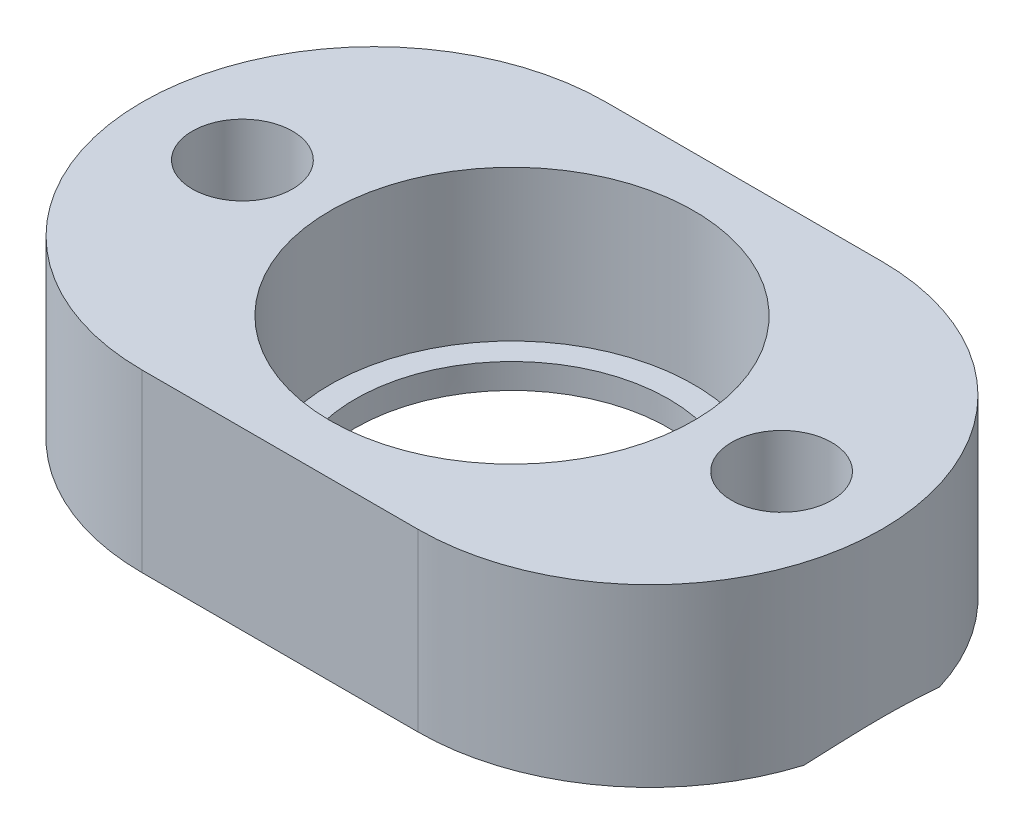
from build123d import *

# Parameters (mm, degrees)
SKETCH1_R           = 2
SKETCH1_R_2         = 7.25
BOSS_EXTRUDE1_DEPTH = 6
BOSS_EXTRUDE2_START = -1
SKETCH1_3_R         = 2
SKETCH1_3_R_2       = 7.25
SKETCH1_3_R_3       = 6.25
BOSS_EXTRUDE2_DEPTH = 1
CHAMFER1_SIZE       = 2.5


with BuildPart() as part:
    # Sketch1 → Boss-Extrude1 (new body)
    with BuildSketch(Plane(origin=(0, 0, 0), x_dir=(1, 0, 0), z_dir=(0, 1, 0))):
        with BuildLine():
            Line((-5.5, -9.25), (5.5, -9.25))
            ThreePointArc((5.5, -9.25), (14.75, 0), (5.5, 9.25))
            Line((5.5, 9.25), (-5.5, 9.25))
            ThreePointArc((-5.5, 9.25), (-14.75, 0), (-5.5, -9.25))
        make_face()
        with Locations(Location((10.75, 0, 0), (0, 0, 270))):
            Circle(SKETCH1_R, mode=Mode.SUBTRACT)
        with Locations(Location((0, 0, 0), (0, 0, 270))):
            Circle(SKETCH1_R_2, mode=Mode.SUBTRACT)
        with Locations(Location((-10.75, 0, 0), (0, 0, 270))):
            Circle(SKETCH1_R, mode=Mode.SUBTRACT)
    extrude(amount=BOSS_EXTRUDE1_DEPTH)

    # Sketch1<3> → Boss-Extrude2 (add)
    # profile 1 of 2: a face of its own
    with BuildSketch(Plane(origin=(0, 0, 0), x_dir=(1, 0, 0), z_dir=(0, 1, 0)).offset(BOSS_EXTRUDE2_START)):
        with BuildLine():
            Line((-5.5, -9.25), (5.5, -9.25))
            ThreePointArc((5.5, -9.25), (14.75, 0), (5.5, 9.25))
            Line((5.5, 9.25), (-5.5, 9.25))
            ThreePointArc((-5.5, 9.25), (-14.75, 0), (-5.5, -9.25))
        make_face()
        with Locations(Location((10.75, 0, 0), (0, 0, 270))):
            Circle(SKETCH1_3_R, mode=Mode.SUBTRACT)
        with Locations(Location((0, 0, 0), (0, 0, 270))):
            Circle(SKETCH1_3_R_2, mode=Mode.SUBTRACT)
        with Locations(Location((-10.75, 0, 0), (0, 0, 270))):
            Circle(SKETCH1_3_R, mode=Mode.SUBTRACT)
    # profile 2 of 2: a face of its own
    with BuildSketch(Plane(origin=(0, 0, 0), x_dir=(1, 0, 0), z_dir=(0, 1, 0)).offset(BOSS_EXTRUDE2_START)):
        with Locations(Location((0, 0, 0), (0, 0, 270))):
            Circle(SKETCH1_3_R_2)
        with Locations(Location((0, 0, 0), (0, 0, 270))):
            Circle(SKETCH1_3_R_3, mode=Mode.SUBTRACT)
    extrude(amount=BOSS_EXTRUDE2_DEPTH)

    # Chamfer1
    # the kernel refuses this chamfer: 2.5 mm, written as the material it takes off along each edge
    with BuildSketch(Plane(origin=(10.75, -1, 0), x_dir=(0, 0, 1), z_dir=(-1, 0, 0))) as chamfer1_piece_1:
        Polygon((2 + CHAMFER1_SIZE, 0), (2, CHAMFER1_SIZE), (2, 0), align=None)
    revolve(axis=Axis((10.75, -1, 0), (0, 1, 0)), mode=Mode.SUBTRACT)
    with BuildSketch(Plane(origin=(-10.75, -1, 0), x_dir=(0, 0, 1), z_dir=(-1, 0, 0))) as chamfer1_piece_2:
        Polygon((2 + CHAMFER1_SIZE, 0), (2, CHAMFER1_SIZE), (2, 0), align=None)
    revolve(axis=Axis((-10.75, -1, 0), (0, 1, 0)), mode=Mode.SUBTRACT)


solid = part.part
